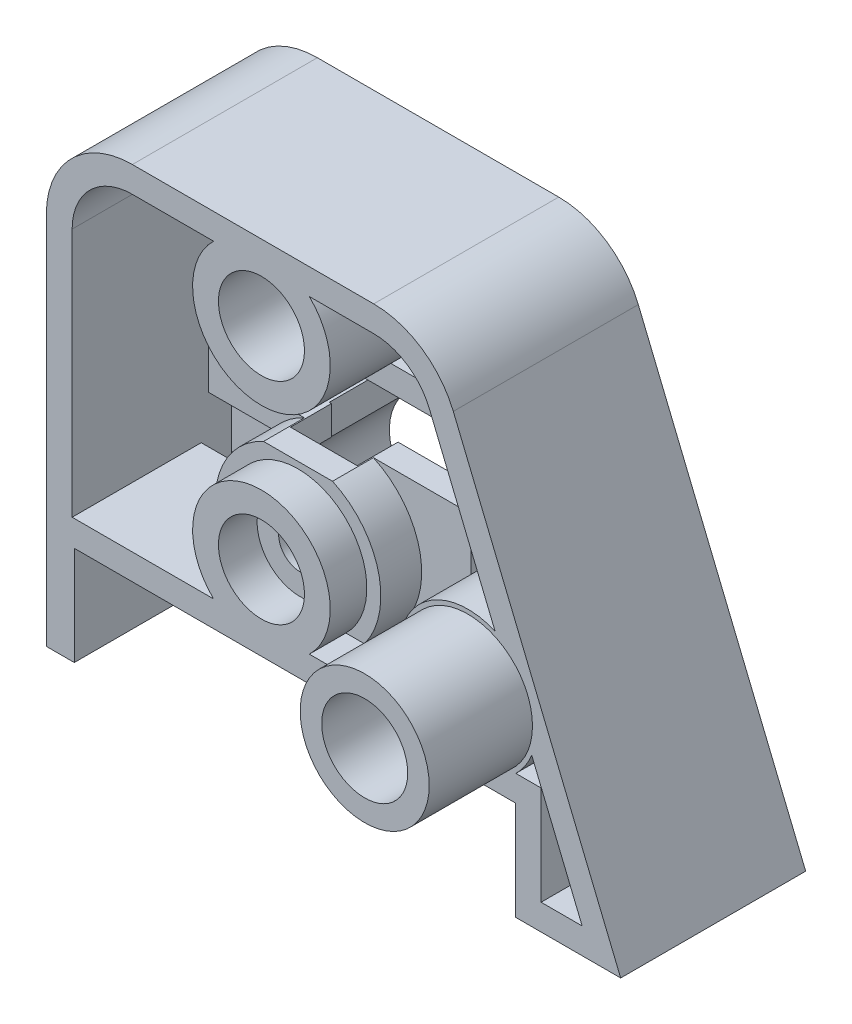
from build123d import *

# Parameters (mm, degrees)
SKETCH1_W           = 17.9
SKETCH1_H           = 21.4
SKETCH1_R           = 1
BOSS_EXTRUDE1_DEPTH = 8.6
FILLET1_R           = 4
SKETCH2_R           = 2
CUT_EXTRUDE1_DEPTH  = 1.8
CUT_EXTRUDE2_START  = -3.8
SKETCH4_R           = 2.65
SKETCH4_W           = 6.6
SKETCH4_H           = 3.8
SKETCH4_W_2         = 12.3
SKETCH4_H_2         = 4.8
CUT_EXTRUDE2_DEPTH  = 3.8
SKETCH5_W           = 10
SKETCH5_H           = 3
CUT_EXTRUDE3_DEPTH  = 22.27422149
CUT_EXTRUDE4_START  = -1.9
SKETCH6_R           = 1
CUT_EXTRUDE4_DEPTH  = 1.9
SKETCH7_W           = 20.5
SKETCH7_H           = 4.6
CUT_EXTRUDE5_DEPTH  = 4.8
SKETCH9_W           = 6.6
SKETCH9_H           = 5
CUT_EXTRUDE6_DEPTH  = 1
SKETCH3_R           = 2
CUT_EXTRUDE7_DEPTH  = 7.4
SKETCH10_R          = 3
BOSS_EXTRUDE2_DEPTH = 4.8
SKETCH11_R          = 2
CUT_EXTRUDE8_DEPTH  = 12.2
SHELL1_START        = -6.688730163
SHELL1_DEPTH        = 6.688730163
SHELL1_START_2      = -3.6
SHELL1_2_OUTLINE_W  = 1.5
SHELL1_2_OUTLINE_H  = 5.4
SHELL1_2_DEPTH      = 3.6
SHELL1_START_3      = -7.4
SHELL1_3_DEPTH      = 1.4
SHELL1_START_4      = -1.7
SHELL1_4_DEPTH      = 1.7
SHELL1_5_DEPTH      = 0.711269837
SHELL1_START_5      = -7.333566942
SHELL1_6_DEPTH      = 0.644836779
SHELL1_START_6      = 3.274859546
SHELL1_7_DEPTH      = 3.925140454
SHELL1_START_7      = -1.8
SHELL1_8_DEPTH      = 0.435460706
CUT_EXTRUDE9_START  = -3.6
CUT_EXTRUDE9_DEPTH  = 3.6
CUT_EXTRUDE10_START = -1.7
CUT_EXTRUDE10_DEPTH = 1.7


with BuildPart() as part:
    # Sketch1 → Boss-Extrude1 (new body)
    # profile 1 of 2: a face of its own
    with BuildSketch(Plane.XY):
        Rectangle(SKETCH1_W, SKETCH1_H)
        with Locations((1.05, -2.6)):
            Circle(SKETCH1_R, mode=Mode.SUBTRACT)
    # profile 2 of 2: a face of its own
    with BuildSketch(Plane.XY):
        Polygon((17.75, -10.7), (8.95, -10.7), (8.95, 10.7), align=None)
    extrude(amount=-BOSS_EXTRUDE1_DEPTH)

    # Fillet1
    fillet1_edges = [part.edges().sort_by_distance(p)[0] for p in [
        (-8.95, 10.7, -4.3),
        (8.95, 10.7, -4.3),
    ]]
    fillet(fillet1_edges, radius=FILLET1_R)

    # Sketch2 → Cut-Extrude1 (cut)
    with BuildSketch(Plane.XY):
        with Locations((1.05, -2.6)):
            Circle(SKETCH2_R)
    extrude(amount=-CUT_EXTRUDE1_DEPTH, mode=Mode.SUBTRACT)

    # Sketch4 → Cut-Extrude2 (cut)
    with BuildSketch(Plane(origin=(0, 0, -8.6), x_dir=(-1, 0, 0), z_dir=(0, 0, -1)).offset(CUT_EXTRUDE2_START)):
        Polygon((-9.2, 0.9), (-6, 0.9), (0.6, 0.9), (3.8, 0.9), (3.8, 3.9), (-9.2, 3.9), align=None)
        with Locations((-1.05, -2.6)):
            Circle(SKETCH4_R)
        with Locations((-2.7, -1)):
            Rectangle(SKETCH4_W, SKETCH4_H)
        with BuildLine():
            ThreePointArc((0.6, -0.526355865), (-2.334562661, -0.28215644), (-3.682964109, -2.9))
            Line((-3.682964109, -2.9), (-2.003939201, -2.9))
            ThreePointArc((-2.003939201, -2.9), (-1.201757699, -1.611582274), (-0.05, -2.6))
            ThreePointArc((-0.05, -2.6), (-0.061582274, -2.751757699), (-0.096060799, -2.9))
            Line((-0.096060799, -2.9), (0.6, -2.9))
            Line((0.6, -2.9), (0.6, -0.526355865))
        make_face()
        with BuildLine():
            Line((-2.003939201, -2.9), (-3.682964109, -2.9))
            ThreePointArc((-3.682964109, -2.9), (-1.465474787, -5.217227675), (1.360616498, -3.700648945))
            Line((1.360616498, -3.700648945), (0.6, -2.9))
            Line((0.6, -2.9), (-0.096060799, -2.9))
            ThreePointArc((-0.096060799, -2.9), (-1.05, -3.6), (-2.003939201, -2.9))
        make_face()
        with BuildLine():
            Line((0.6, -2.9), (1.360616498, -3.700648945))
            ThreePointArc((1.360616498, -3.700648945), (1.539462658, -3.163190146), (1.6, -2.6))
            ThreePointArc((1.6, -2.6), (1.336943652, -1.448913557), (0.6, -0.526355865))
            Line((0.6, -0.526355865), (0.6, -2.9))
        make_face()
        Polygon((-6, -2.9), (0.6, -2.9), (3.45, -5.9), (-8.85, -5.9), align=None)
        with Locations((-2.7, -8.3)):
            Rectangle(SKETCH4_W_2, SKETCH4_H_2)
    extrude(amount=CUT_EXTRUDE2_DEPTH, mode=Mode.SUBTRACT)

    # Sketch5 → Cut-Extrude3 (cut, through all)
    with BuildSketch(Plane(origin=(0, 0, -4.8), x_dir=(-1, 0, 0), z_dir=(0, 0, -1))):
        with Locations((-2.7, 2.4)):
            Rectangle(SKETCH5_W, SKETCH5_H)
    extrude(amount=-CUT_EXTRUDE3_DEPTH, mode=Mode.SUBTRACT)

    # Sketch6 → Cut-Extrude4 (cut)
    # profile 1 of 5: a face of its own
    with BuildSketch(Plane(origin=(0, 0, -4.8), x_dir=(-1, 0, 0), z_dir=(0, 0, -1)).offset(CUT_EXTRUDE4_START)):
        with BuildLine():
            ThreePointArc((-2.6, -0.450581474), (-3.7, -2.6), (-2.6, -4.749418526))
            Line((-2.6, -4.749418526), (-2.6, -0.450581474))
        make_face()
    # profile 2 of 5: a face of its own
    with BuildSketch(Plane(origin=(0, 0, -4.8), x_dir=(-1, 0, 0), z_dir=(0, 0, -1)).offset(CUT_EXTRUDE4_START)):
        with BuildLine():
            Line((-2.6, -0.450581474), (-2.6, -4.749418526))
            ThreePointArc((-2.6, -4.749418526), (-1.05, -5.25), (0.5, -4.749418526))
            Line((0.5, -4.749418526), (0.5, -0.450581474))
            ThreePointArc((0.5, -0.450581474), (-1.05, 0.05), (-2.6, -0.450581474))
        make_face()
        with Locations(Location((-1.05, -2.6, 0), (0, 0, 180))):
            Circle(SKETCH6_R, mode=Mode.SUBTRACT)
    # profile 3 of 5: a face of its own
    with BuildSketch(Plane(origin=(0, 0, -4.8), x_dir=(-1, 0, 0), z_dir=(0, 0, -1)).offset(CUT_EXTRUDE4_START)):
        with BuildLine():
            Line((-2.6, 0.9), (-2.6, -0.450581474))
            ThreePointArc((-2.6, -0.450581474), (-1.05, 0.05), (0.5, -0.450581474))
            Line((0.5, -0.450581474), (0.5, 0.9))
            Line((0.5, 0.9), (-2.6, 0.9))
        make_face()
    # profile 4 of 5: a face of its own
    with BuildSketch(Plane(origin=(0, 0, -4.8), x_dir=(-1, 0, 0), z_dir=(0, 0, -1)).offset(CUT_EXTRUDE4_START)):
        with BuildLine():
            Line((0.5, -0.450581474), (0.5, -4.749418526))
            ThreePointArc((0.5, -4.749418526), (0.998560511, -4.281041294), (1.360616498, -3.700648945))
            ThreePointArc((1.360616498, -3.700648945), (1.539462658, -3.163190146), (1.6, -2.6))
            ThreePointArc((1.6, -2.6), (1.336943652, -1.448913557), (0.6, -0.526355865))
            ThreePointArc((0.6, -0.526355865), (0.550448512, -0.487876765), (0.5, -0.450581474))
        make_face()
    # profile 5 of 5: a face of its own
    with BuildSketch(Plane(origin=(0, 0, -4.8), x_dir=(-1, 0, 0), z_dir=(0, 0, -1)).offset(CUT_EXTRUDE4_START)):
        with BuildLine():
            Line((-2.6, -4.749418526), (-2.6, -6.1))
            Line((-2.6, -6.1), (0.5, -6.1))
            Line((0.5, -6.1), (0.5, -4.749418526))
            ThreePointArc((0.5, -4.749418526), (-1.05, -5.25), (-2.6, -4.749418526))
        make_face()
    extrude(amount=CUT_EXTRUDE4_DEPTH, mode=Mode.SUBTRACT)

    # Sketch7 → Cut-Extrude5 (cut)
    with BuildSketch(Plane.XY):
        with Locations((2.6, -8.4)):
            Rectangle(SKETCH7_W, SKETCH7_H)
    extrude(amount=-CUT_EXTRUDE5_DEPTH, mode=Mode.SUBTRACT)

    # Sketch9 → Cut-Extrude6 (cut)
    with BuildSketch(Plane(origin=(0, -2.35, -2.35), x_dir=(-1, 0, 0), z_dir=(0, -0.7071067811865561, -0.7071067811865389))):
        with Locations((-2.7, 9.217514421)):
            Rectangle(SKETCH9_W, SKETCH9_H)
    extrude(amount=-CUT_EXTRUDE6_DEPTH, mode=Mode.SUBTRACT)

    # Sketch3 → Cut-Extrude7 (cut)
    with BuildSketch(Plane.XY):
        with Locations((1.05, 7.2)):
            Circle(SKETCH3_R)
    extrude(amount=-CUT_EXTRUDE7_DEPTH, mode=Mode.SUBTRACT)

    # Sketch10 → Boss-Extrude2 (add)
    with BuildSketch(Plane.XY):
        with Locations((10.65, -2.6)):
            Circle(SKETCH10_R)
    extrude(amount=BOSS_EXTRUDE2_DEPTH)

    # Sketch11 → Cut-Extrude8 (cut)
    with BuildSketch(Plane.XY.offset(4.8)):
        with Locations((10.65, -2.6)):
            Circle(SKETCH11_R)
    extrude(amount=-CUT_EXTRUDE8_DEPTH, mode=Mode.SUBTRACT)

    # Shell1: read off the stored shape, not the designer's step
    # Shell1 outline → Shell1 (cut)
    with BuildSketch(Plane.XY.offset(SHELL1_START)):
        with BuildLine():
            Line((8.425140454, -0.3), (7.2, -0.3))
            Line((7.2, -0.3), (7.2, -2.420869782))
            Line((7.2, -2.420869782), (7.451135024, -2.685222439))
            ThreePointArc((7.451135024, -2.685222439), (7.687481064, -1.390255582), (8.425140454, -0.3))
        make_face()
        with BuildLine():
            Line((-4.155173707, -4.9), (-2.718545428, -3.387759707))
            ThreePointArc((-2.718545428, -3.387759707), (-2.709630033, -1.770734053), (-2.037474696, -0.3))
            Line((-2.037474696, -0.3), (-5, -0.3))
            Line((-5, -0.3), (-5, 5.1))
            Line((-5, 5.1), (-1.364539294, 5.1))
            ThreePointArc((-1.364539294, 5.1), (-2.147030716, 7.337820904), (-1.174859546, 9.5))
            Line((-1.174859546, 9.5), (-4.95, 9.5))
            ThreePointArc((-4.95, 9.5), (-6.929898987, 8.679898987), (-7.75, 6.7))
            Line((-7.75, 6.7), (-7.75, -4.9))
            Line((-7.75, -4.9), (-4.155173707, -4.9))
        make_face()
        with BuildLine():
            Line((12.874859546, -4.9), (14.05, -4.9))
            Line((14.05, -4.9), (14.05, -9.5))
            Line((14.05, -9.5), (15.959044178, -9.5))
            Line((15.959044178, -9.5), (13.615804478, -3.801667092))
            ThreePointArc((13.615804478, -3.801667092), (13.302797023, -4.389599942), (12.874859546, -4.9))
        make_face()
        with BuildLine():
            ThreePointArc((10.4, 0.590219428), (11.17143883, 0.557230043), (11.912517793, 0.340416437))
            Line((11.912517793, 0.340416437), (10.4, 4.018584707))
            Line((10.4, 4.018584707), (10.4, 0.590219428))
        make_face()
        with BuildLine():
            Line((7.2, 5.1), (9.955305861, 5.1))
            Line((9.955305861, 5.1), (8.859466499, 7.764882083))
            ThreePointArc((8.859466499, 7.764882083), (7.828444792, 9.026120142), (6.269866888, 9.5))
            Line((6.269866888, 9.5), (3.274859546, 9.5))
            ThreePointArc((3.274859546, 9.5), (4.247030716, 7.337820904), (3.464539294, 5.1))
            Line((3.464539294, 5.1), (7.2, 5.1))
        make_face()
    extrude(amount=SHELL1_DEPTH, mode=Mode.SUBTRACT)

    # Shell1 2 outline → Shell1 2 (cut)
    with BuildSketch(Plane.XY.offset(SHELL1_START_2)):
        with BuildLine():
            Line((7.2, -0.3), (4.137474696, -0.3))
            ThreePointArc((4.137474696, -0.3), (4.9, -2.6), (4.137474696, -4.9))
            Line((4.137474696, -4.9), (8.425140454, -4.9))
            ThreePointArc((8.425140454, -4.9), (7.720749783, -3.888213168), (7.451135024, -2.685222439))
            Line((7.451135024, -2.685222439), (7.2, -2.420869782))
            Line((7.2, -2.420869782), (7.2, -0.3))
        make_face()
        with BuildLine():
            Line((-4.155173707, -4.9), (-2.037474696, -4.9))
            ThreePointArc((-2.037474696, -4.9), (-2.460408902, -4.180989987), (-2.718545428, -3.387759707))
            Line((-2.718545428, -3.387759707), (-4.155173707, -4.9))
        make_face()
        with Locations((-4.25, 2.4)):
            Rectangle(SHELL1_2_OUTLINE_W, SHELL1_2_OUTLINE_H)
        with BuildLine():
            ThreePointArc((8.9, 0.079085665), (9.617859297, 0.428974342), (10.4, 0.590219428))
            Line((10.4, 0.590219428), (10.4, 4.018584707))
            Line((10.4, 4.018584707), (9.95530586, 5.1))
            Line((9.95530586, 5.1), (8.9, 5.1))
            Line((8.9, 5.1), (8.9, 0.079085665))
        make_face()
    extrude(amount=SHELL1_2_DEPTH, mode=Mode.SUBTRACT)

    # Shell1 3 outline → Shell1 3 (cut)
    with BuildSketch(Plane.XY.offset(SHELL1_START_3)):
        with BuildLine():
            Line((8.425140454, -0.3), (7.2, -0.3))
            Line((7.2, -0.3), (7.2, -2.420869782))
            Line((7.2, -2.420869782), (7.451135024, -2.685222439))
            ThreePointArc((7.451135024, -2.685222439), (7.687481064, -1.390255582), (8.425140454, -0.3))
        make_face()
        with BuildLine():
            ThreePointArc((-2.718545428, -3.387759707), (-2.709630033, -1.770734053), (-2.037474696, -0.3))
            Line((-2.037474696, -0.3), (-5, -0.3))
            Line((-5, -0.3), (-5, 5.1))
            Line((-5, 5.1), (-1.8, 5.1))
            Line((-1.8, 5.1), (-1.8, 5.744836779))
            ThreePointArc((-1.8, 5.744836779), (-2.106558657, 7.725487814), (-1.174859546, 9.5))
            Line((-1.174859546, 9.5), (-4.95, 9.5))
            ThreePointArc((-4.95, 9.5), (-6.929898987, 8.679898987), (-7.75, 6.7))
            Line((-7.75, 6.7), (-7.75, -9.5))
            Line((-7.75, -9.5), (-4.65, -9.5))
            Line((-4.65, -9.5), (-4.65, -5.420869782))
            Line((-4.65, -5.420869782), (-2.718545428, -3.387759707))
        make_face()
        with BuildLine():
            Line((10.05, -9.5), (15.959044178, -9.5))
            Line((15.959044178, -9.5), (13.615804478, -3.801667092))
            ThreePointArc((13.615804478, -3.801667092), (12.180258337, -5.410393108), (10.05, -5.743246729))
            Line((10.05, -5.743246729), (10.05, -9.5))
        make_face()
        with BuildLine():
            ThreePointArc((10.4, 0.590219428), (11.17143883, 0.557230043), (11.912517793, 0.340416437))
            Line((11.912517793, 0.340416437), (10.4, 4.018584707))
            Line((10.4, 4.018584707), (10.4, 0.590219428))
        make_face()
    extrude(amount=SHELL1_3_DEPTH, mode=Mode.SUBTRACT)

    # Shell1 4 outline → Shell1 4 (cut)
    with BuildSketch(Plane.XY.offset(SHELL1_START_4)):
        with BuildLine():
            ThreePointArc((4.137474696, -4.9), (4.9, -2.6), (4.137474696, -0.3))
            Line((4.137474696, -0.3), (3.274859546, -0.3))
            ThreePointArc((3.274859546, -0.3), (4.25, -2.6), (3.274859546, -4.9))
            Line((3.274859546, -4.9), (4.137474696, -4.9))
        make_face()
        with BuildLine():
            ThreePointArc((-2.037474696, -0.3), (-2.8, -2.6), (-2.037474696, -4.9))
            Line((-2.037474696, -4.9), (-1.174859546, -4.9))
            ThreePointArc((-1.174859546, -4.9), (-2.15, -2.6), (-1.174859546, -0.3))
            Line((-1.174859546, -0.3), (-2.037474696, -0.3))
        make_face()
    extrude(amount=SHELL1_4_DEPTH, mode=Mode.SUBTRACT)

    # Shell1 5 outline → Shell1 5 (cut)
    with BuildSketch(Plane.XY.offset(SHELL1_START_3)):
        with BuildLine():
            Line((9.95530586, 5.1), (8.859466499, 7.764882083))
            ThreePointArc((8.859466499, 7.764882083), (7.828444792, 9.026120142), (6.269866888, 9.5))
            Line((6.269866888, 9.5), (3.274859546, 9.5))
            ThreePointArc((3.274859546, 9.5), (4.247030716, 7.337820904), (3.464539294, 5.1))
            Line((3.464539294, 5.1), (7.2, 5.1))
            Line((7.2, 5.1), (9.95530586, 5.1))
        make_face()
    extrude(amount=SHELL1_5_DEPTH, mode=Mode.SUBTRACT)

    # Shell1 6 outline → Shell1 6 (cut)
    with BuildSketch(Plane.XY.offset(SHELL1_START_5)):
        with BuildLine():
            ThreePointArc((-1.364539294, 5.1), (-1.60194214, 5.409133481), (-1.8, 5.744836779))
            Line((-1.8, 5.744836779), (-1.8, 5.1))
            Line((-1.8, 5.1), (-1.364539294, 5.1))
        make_face()
    extrude(amount=SHELL1_6_DEPTH, mode=Mode.SUBTRACT)

    # Shell1 7 outline → Shell1 7 (add)
    with BuildSketch(Plane.YZ.offset(SHELL1_START_6)):
        Polygon((5.1, -7.4), (5.811269837, -7.4), (5.1, -6.688730163), align=None)
    extrude(amount=SHELL1_7_DEPTH)

    # Shell1 8 outline → Shell1 8 (add)
    with BuildSketch(Plane.YZ.offset(SHELL1_START_7)):
        Polygon((5.1, -7.333566942), (5.744836779, -7.333566942), (5.1, -6.688730163), align=None)
    extrude(amount=SHELL1_8_DEPTH)

    # Sketch14 → Cut-Extrude9 (cut)
    with BuildSketch(Plane.XY.offset(CUT_EXTRUDE9_START)):
        with BuildLine():
            Line((-1.364539294, 5.1), (-3.5, 5.1))
            Line((-3.5, 5.1), (-3.5, -0.3))
            Line((-3.5, -0.3), (-2.037474696, -0.3))
            ThreePointArc((-2.037474696, -0.3), (-1.371208921, 0.393367228), (-0.553901493, 0.9))
            Line((-0.553901493, 0.9), (-2.3, 0.9))
            Line((-2.3, 0.9), (-2.3, 3.9))
            Line((-2.3, 3.9), (7.7, 3.9))
            Line((7.7, 3.9), (7.7, 0.9))
            Line((7.7, 0.9), (2.653901493, 0.9))
            ThreePointArc((2.653901493, 0.9), (3.471208921, 0.393367228), (4.137474696, -0.3))
            Line((4.137474696, -0.3), (8.425140454, -0.3))
            ThreePointArc((8.425140454, -0.3), (8.653552258, -0.099160858), (8.9, 0.079085665))
            Line((8.9, 0.079085665), (8.9, 5.1))
            Line((8.9, 5.1), (3.464539294, 5.1))
            ThreePointArc((3.464539294, 5.1), (1.05, 4), (-1.364539294, 5.1))
        make_face()
    extrude(amount=CUT_EXTRUDE9_DEPTH, mode=Mode.SUBTRACT)

    # Sketch15 → Cut-Extrude10 (cut)
    with BuildSketch(Plane.XY.offset(CUT_EXTRUDE10_START)):
        with BuildLine():
            ThreePointArc((-0.553901493, 0.9), (-1.371208921, 0.393367228), (-2.037474696, -0.3))
            Line((-2.037474696, -0.3), (-1.174859546, -0.3))
            ThreePointArc((-1.174859546, -0.3), (1.05, 0.6), (3.274859546, -0.3))
            Line((3.274859546, -0.3), (4.137474696, -0.3))
            ThreePointArc((4.137474696, -0.3), (3.471208921, 0.393367228), (2.653901493, 0.9))
            Line((2.653901493, 0.9), (-0.553901493, 0.9))
        make_face()
    extrude(amount=CUT_EXTRUDE10_DEPTH, mode=Mode.SUBTRACT)


solid = part.part
